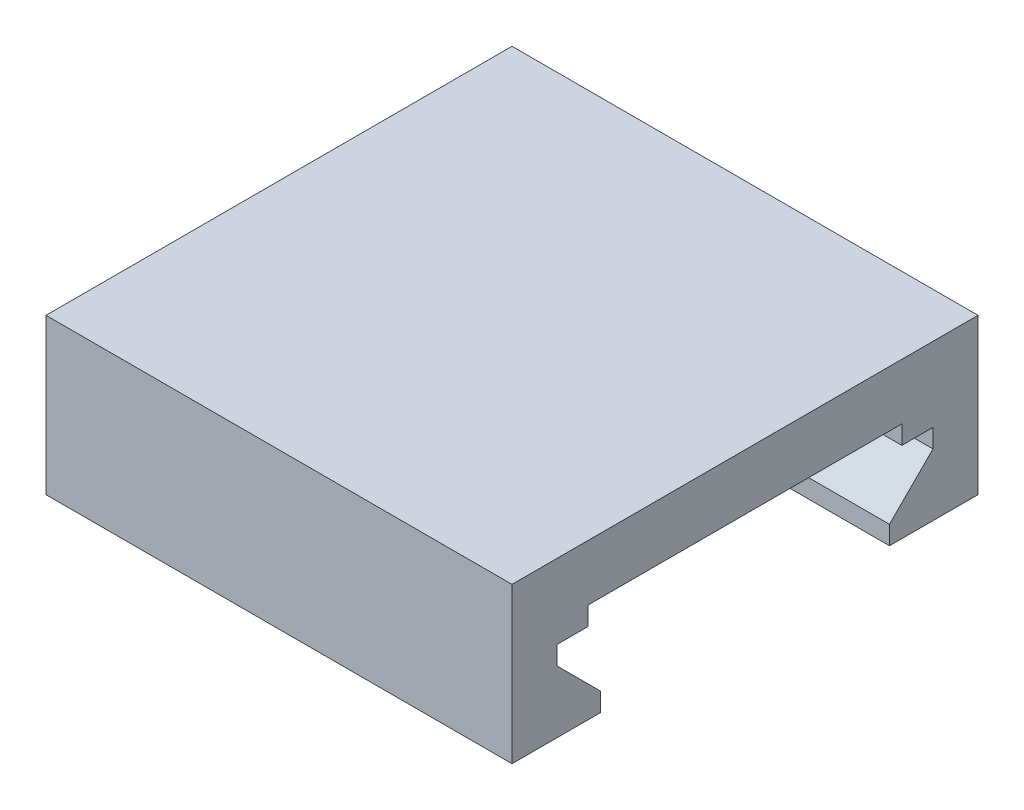
from build123d import *

# Parameters (mm, degrees)
BOSS_EXTRUDE1_DEPTH = 7.5


with BuildPart() as part:
    # LED Groove Profile Test → Boss-Extrude1 (new, symmetric)
    with BuildSketch(Plane(origin=(0, 0, 0), x_dir=(0, 0, -1), z_dir=(1, 0, 0))):
        Polygon((-4.65, 2.792304845), (-4.65, 2.192304845), (-7.5, 2.192304845), (-7.5, 7.192304845), (7.5, 7.192304845), (7.5, 2.192304845), (4.65, 2.192304845), (4.65, 2.792304845), (6.05, 4.192304845), (6.05, 4.792304845), (5.05, 4.792304845), (5.05, 5.392304845), (-5.05, 5.392304845), (-5.05, 4.792304845), (-6.05, 4.792304845), (-6.05, 4.192304845), align=None)
    extrude(amount=BOSS_EXTRUDE1_DEPTH, both=True)


solid = part.part
